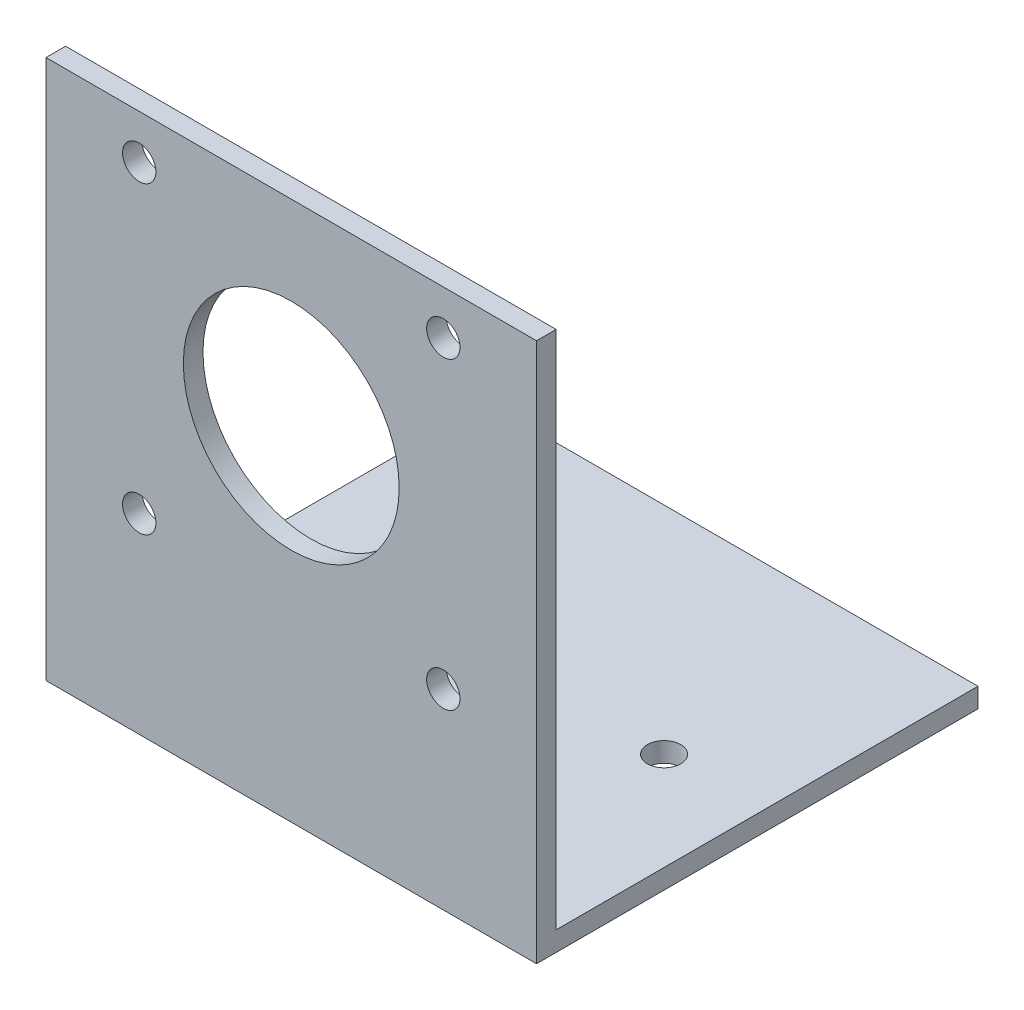
from build123d import *

# Parameters (mm, degrees)
SKETCH1_W                 = 50
SKETCH1_H                 = 55
BOSS_EXTRUDE1_DEPTH       = 2
SKETCH2_W                 = 50
SKETCH2_H                 = 2
BOSS_EXTRUDE2_DEPTH       = 45
CUT_EXTRUDE1_DEPTH        = 76.332595867
CUT_EXTRUDE1_DEPTH_BACK   = 76.332595867
SKETCH3_R                 = 1.7
LO_TAM_D22_DEPTH          = 76.332595867
LO_TAM_D22_DEPTH_BACK     = 76.332595867
SKETCH4_R                 = 11
HAI_LO_CHAN_M3_DEPTH      = 76.332595867
HAI_LO_CHAN_M3_DEPTH_BACK = 76.332595867
SKETCH5_R                 = 1.7


with BuildPart() as part:
    # Sketch1 → Boss-Extrude1 (new body)
    with BuildSketch(Plane.XY):
        with Locations((0, 27.5)):
            Rectangle(SKETCH1_W, SKETCH1_H)
    extrude(amount=-BOSS_EXTRUDE1_DEPTH)

    # Sketch2 → Boss-Extrude2 (add)
    with BuildSketch(Plane.XY):
        with Locations((0, 1)):
            Rectangle(SKETCH2_W, SKETCH2_H)
    extrude(amount=-BOSS_EXTRUDE2_DEPTH)

    # Sketch3 → Cut-Extrude1 (cut, two sides: drawn at the far end of the back side and taken through both)
    with BuildSketch(Plane.XY.offset(-CUT_EXTRUDE1_DEPTH_BACK)):
        with Locations((-15.5, 19.5)):
            Circle(SKETCH3_R)
        with Locations((-15.5, 50.5)):
            Circle(SKETCH3_R)
        with Locations((15.5, 19.5)):
            Circle(SKETCH3_R)
        with Locations((15.5, 50.5)):
            Circle(SKETCH3_R)
    extrude(amount=CUT_EXTRUDE1_DEPTH + CUT_EXTRUDE1_DEPTH_BACK, mode=Mode.SUBTRACT)

    # Sketch4 → Lo_tam_D22 (cut, two sides: drawn at the far end of the back side and taken through both)
    with BuildSketch(Plane.XY.offset(-LO_TAM_D22_DEPTH_BACK)):
        with Locations((0, 35)):
            Circle(SKETCH4_R)
    extrude(amount=LO_TAM_D22_DEPTH + LO_TAM_D22_DEPTH_BACK, mode=Mode.SUBTRACT)

    # Sketch5 → Hai_lo_chan_M3 (cut, two sides: drawn at the far end of the back side and taken through both)
    with BuildSketch(Plane(origin=(0, 0, 0), x_dir=(1, 0, 0), z_dir=(0, 1, 0)).offset(-HAI_LO_CHAN_M3_DEPTH_BACK)):
        with Locations((-15, 23)):
            Circle(SKETCH5_R)
        with Locations((15, 23)):
            Circle(SKETCH5_R)
    extrude(amount=HAI_LO_CHAN_M3_DEPTH + HAI_LO_CHAN_M3_DEPTH_BACK, mode=Mode.SUBTRACT)


solid = part.part
